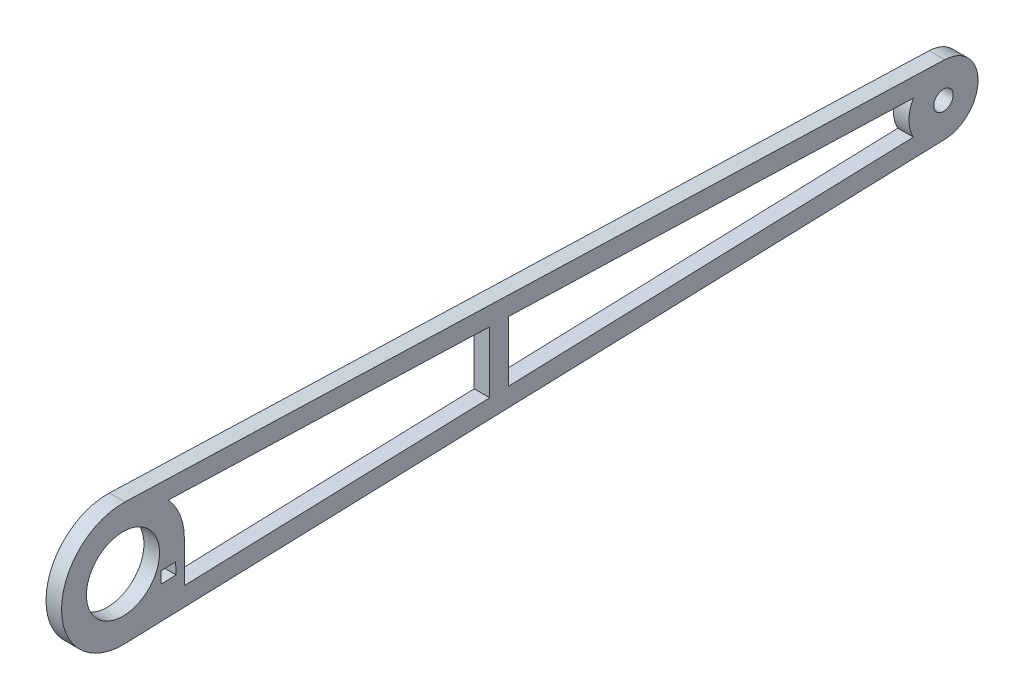
from build123d import *

# Parameters (mm, degrees)
SKETCH1_R           = 0.9906
SKETCH1_R_2         = 3.7338
BOSS_EXTRUDE1_DEPTH = 1.5875


with BuildPart() as part:
    # Sketch1 → Boss-Extrude1 (new body)
    with BuildSketch(Plane(origin=(0, 0, 0), x_dir=(0, 0, -1), z_dir=(1, 0, 0))):
        with BuildLine():
            Line((83.935546909, 3.528708726), (0.205324364, 6.270439247))
            ThreePointArc((0.205324364, 6.270439247), (-6.2738, 2.3e-08), (0.205324317, -6.270439248))
            Line((0.205324317, -6.270439248), (83.935546909, -3.528708726))
            ThreePointArc((83.935546909, -3.528708726), (87.3506, 0), (83.935546909, 3.528708726))
        make_face()
        with BuildLine():
            Line((39.37, 3.081978229), (80.740783809, 1.727299629))
            ThreePointArc((80.740783809, 1.727299629), (80.2894, 0), (80.740783809, -1.727299629))
            Line((80.740783809, -1.727299629), (39.37, -3.081978229))
            Line((39.37, -3.081978229), (39.37, 3.081978229))
        make_face(mode=Mode.SUBTRACT)
        with BuildLine():
            Line((4.643249776, 4.219099188), (37.465, 3.144357099))
            Line((37.465, 3.144357099), (37.465, -3.144357099))
            Line((37.465, -3.144357099), (6.2738, -4.165707125))
            Line((6.2738, -4.165707125), (6.2738, 0))
            ThreePointArc((6.2738, 0), (5.85198201, 2.261608498), (4.643249776, 4.219099188))
        make_face(mode=Mode.SUBTRACT)
        with Locations((83.82, 0)):
            Circle(SKETCH1_R, mode=Mode.SUBTRACT)
        Circle(SKETCH1_R_2, mode=Mode.SUBTRACT)
        Polygon((3.867362033, -1.661691128), (5.377435828, -1.600823876), (5.425515843, -2.793655277), (3.915442047, -2.85452253), align=None, mode=Mode.SUBTRACT)
    extrude(amount=BOSS_EXTRUDE1_DEPTH)


solid = part.part
